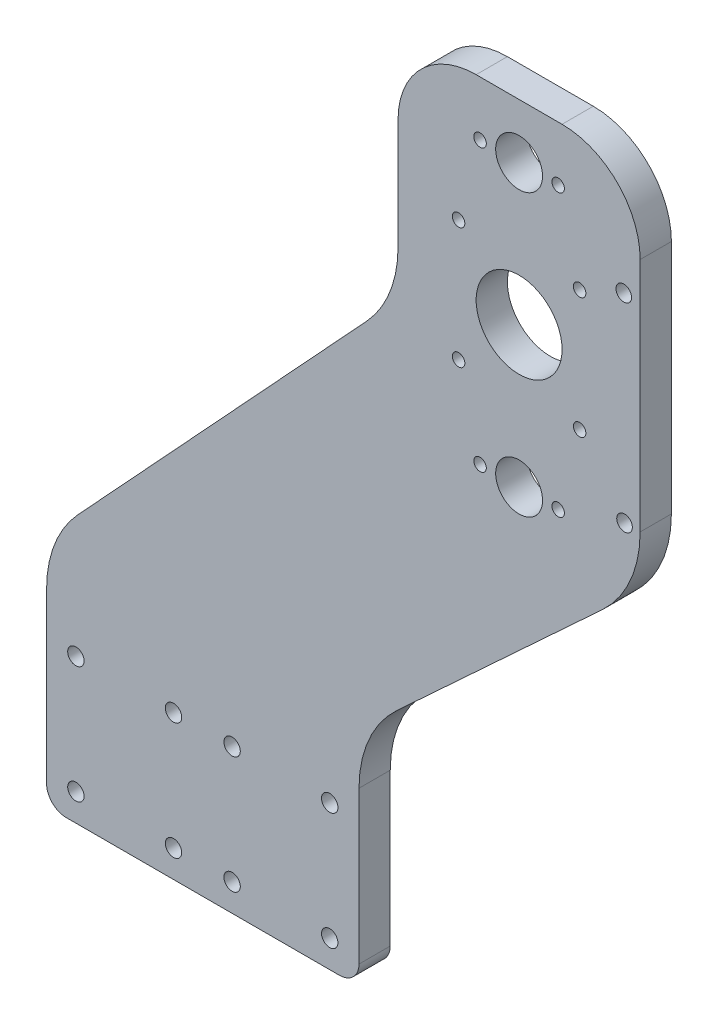
from build123d import *

# Parameters (mm, degrees)
SKETCH1_R           = 2.1
SKETCH1_R_2         = 6
SKETCH1_R_3         = 11
SKETCH1_R_4         = 1.6
SKETCH1_R_5         = 2
BOSS_EXTRUDE1_DEPTH = 8


with BuildPart() as part:
    # Sketch1 → Boss-Extrude1 (new body)
    with BuildSketch(Plane.XY):
        with BuildLine():
            Line((-58.450315728, -99.207311363), (11.549684272, -99.207311363))
            ThreePointArc((11.549684272, -99.207311363), (15.085218178, -97.742845269), (16.549684272, -94.207311363))
            Line((16.549684272, -94.207311363), (16.549684272, -55.206132823))
            ThreePointArc((16.549684272, -55.206132823), (19.062073387, -43.188177597), (26.178434127, -33.18314103))
            Line((26.178434127, -33.18314103), (78.920934418, 15.603630397))
            ThreePointArc((78.920934418, 15.603630397), (86.037295158, 25.608666964), (88.549684272, 37.62662219))
            Line((88.549684272, 37.62662219), (88.549684272, 98.042585462))
            ThreePointArc((88.549684272, 98.042585462), (82.691819896, 112.184721085), (68.549684272, 118.042585462))
            Line((68.549684272, 118.042585462), (46.549684272, 118.042585462))
            ThreePointArc((46.549684272, 118.042585462), (32.407548649, 112.184721085), (26.549684272, 98.042585462))
            Line((26.549684272, 98.042585462), (26.549684272, 69.794245525))
            ThreePointArc((26.549684272, 69.794245525), (24.483006881, 58.852148467), (18.567718404, 49.417637049))
            Line((18.567718404, 49.417637049), (-55.46834986, -30.582362951))
            ThreePointArc((-55.46834986, -30.582362951), (-61.383638337, -40.016874369), (-63.450315728, -50.958971426))
            Line((-63.450315728, -50.958971426), (-63.450315728, -94.207311363))
            ThreePointArc((-63.450315728, -94.207311363), (-61.985849634, -97.742845269), (-58.450315728, -99.207311363))
        make_face()
        with Locations((-55.950315728, -62.207311363)):
            Circle(SKETCH1_R, mode=Mode.SUBTRACT)
        with Locations((-30.950315728, -62.207311363)):
            Circle(SKETCH1_R, mode=Mode.SUBTRACT)
        with Locations((-30.950315728, -92.207311363)):
            Circle(SKETCH1_R, mode=Mode.SUBTRACT)
        with Locations((-55.950315728, -92.207311363)):
            Circle(SKETCH1_R, mode=Mode.SUBTRACT)
        with Locations((9.049684272, -92.207311363)):
            Circle(SKETCH1_R, mode=Mode.SUBTRACT)
        with Locations((-15.950315728, -92.207311363)):
            Circle(SKETCH1_R, mode=Mode.SUBTRACT)
        with Locations((-15.950315728, -62.207311363)):
            Circle(SKETCH1_R, mode=Mode.SUBTRACT)
        with Locations((9.049684272, -62.207311363)):
            Circle(SKETCH1_R, mode=Mode.SUBTRACT)
        with Locations((57.549684272, 104.042585462)):
            Circle(SKETCH1_R_2, mode=Mode.SUBTRACT)
        with Locations((57.549684272, 32.102585462)):
            Circle(SKETCH1_R_2, mode=Mode.SUBTRACT)
        with Locations((57.549684272, 68.072585462)):
            Circle(SKETCH1_R_3, mode=Mode.SUBTRACT)
        with Locations((42.049684272, 83.572585462)):
            Circle(SKETCH1_R_4, mode=Mode.SUBTRACT)
        with Locations((73.049684272, 83.572585462)):
            Circle(SKETCH1_R_4, mode=Mode.SUBTRACT)
        with Locations((73.049684272, 52.572585462)):
            Circle(SKETCH1_R_4, mode=Mode.SUBTRACT)
        with Locations((42.049684272, 52.572585462)):
            Circle(SKETCH1_R_4, mode=Mode.SUBTRACT)
        with Locations((84.549684272, 37.62662219)):
            Circle(SKETCH1_R_5, mode=Mode.SUBTRACT)
        with Locations((84.351781192, 88.518513838)):
            Circle(SKETCH1_R_5, mode=Mode.SUBTRACT)
        with Locations((47.549684272, 104.042585462)):
            Circle(SKETCH1_R_4, mode=Mode.SUBTRACT)
        with Locations((47.549684272, 32.102585462)):
            Circle(SKETCH1_R_4, mode=Mode.SUBTRACT)
        with Locations((67.549684272, 104.042585462)):
            Circle(SKETCH1_R_4, mode=Mode.SUBTRACT)
        with Locations((67.549684272, 32.102585462)):
            Circle(SKETCH1_R_4, mode=Mode.SUBTRACT)
    extrude(amount=BOSS_EXTRUDE1_DEPTH)


solid = part.part
